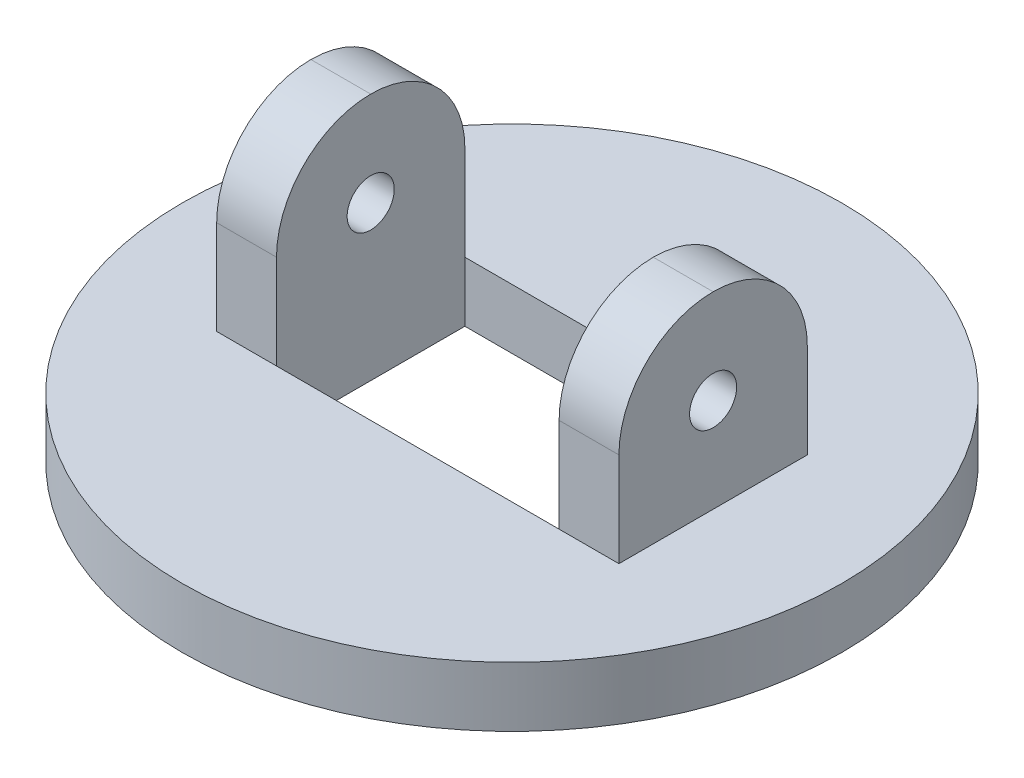
from build123d import *

# Parameters (mm, degrees)
SKETCH1_R           = 35
SKETCH1_W           = 30
SKETCH1_H           = 20
BOSS_EXTRUDE1_DEPTH = 6.35
SKETCH2_W           = 6.35
SKETCH2_H           = 20
BOSS_EXTRUDE2_DEPTH = 20
SKETCH3_R           = 2.5
CUT_EXTRUDE1_DEPTH  = 57
FILLET1_R           = 10


with BuildPart() as part:
    # Sketch1 → Boss-Extrude1 (new body)
    with BuildSketch(Plane(origin=(0, 0, 0), x_dir=(1, 0, 0), z_dir=(0, 1, 0))):
        with Locations(Location((0, 0, 0), (0, 0, 270))):
            Circle(SKETCH1_R)
        Rectangle(SKETCH1_W, SKETCH1_H, mode=Mode.SUBTRACT)
    extrude(amount=BOSS_EXTRUDE1_DEPTH)

    # Sketch2 → Boss-Extrude2 (add)
    with BuildSketch(Plane(origin=(0, 6.35, 0), x_dir=(1, 0, 0), z_dir=(0, 1, 0))):
        with Locations((-18.175, 0)):
            Rectangle(SKETCH2_W, SKETCH2_H)
        with Locations((18.175, 0)):
            Rectangle(SKETCH2_W, SKETCH2_H)
    extrude(amount=BOSS_EXTRUDE2_DEPTH)

    # Sketch3 → Cut-Extrude1 (cut)
    with BuildSketch(Plane(origin=(21.35, 0, 0), x_dir=(0, 0, -1), z_dir=(1, 0, 0))):
        with Locations((0, 16.35)):
            Circle(SKETCH3_R)
    extrude(amount=-CUT_EXTRUDE1_DEPTH, mode=Mode.SUBTRACT)

    # Fillet1
    fillet1_edges = [part.edges().sort_by_distance(p)[0] for p in [
        (18.175, 26.35, -10),
        (18.175, 26.35, 10),
        (-18.175, 26.35, -10),
        (-18.175, 26.35, 10),
    ]]
    fillet(fillet1_edges, radius=FILLET1_R - 0.0001)  # a hair under: the kernel refuses the full size


solid = part.part
